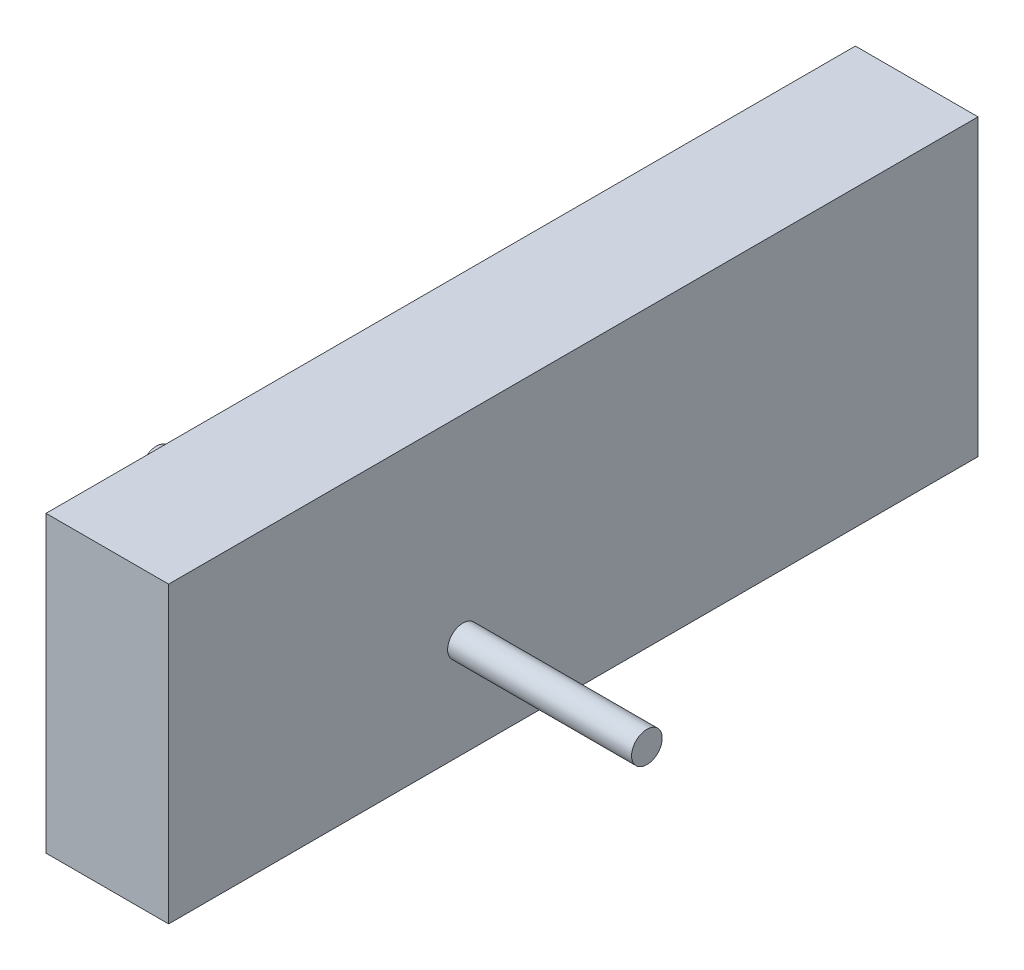
from build123d import *

# Parameters (mm, degrees)
SKETCH1_R           = 7.9375
BOSS_EXTRUDE1_DEPTH = 127
SKETCH2_W           = 419.1
SKETCH2_H           = 152.4
BOSS_EXTRUDE2_DEPTH = 31.75


with BuildPart() as part:
    # Sketch1 → Boss-Extrude1 (new, symmetric)
    with BuildSketch(Plane(origin=(0, 0, 0), x_dir=(0, 0, -1), z_dir=(1, 0, 0))):
        Circle(SKETCH1_R)
    extrude(amount=BOSS_EXTRUDE1_DEPTH, both=True)

    # Sketch2 → Boss-Extrude2 (add, symmetric)
    with BuildSketch(Plane(origin=(0, 0, 0), x_dir=(0, 0, -1), z_dir=(1, 0, 0))):
        with Locations((57.15, 25.4)):
            Rectangle(SKETCH2_W, SKETCH2_H)
    extrude(amount=BOSS_EXTRUDE2_DEPTH, both=True)


solid = part.part
